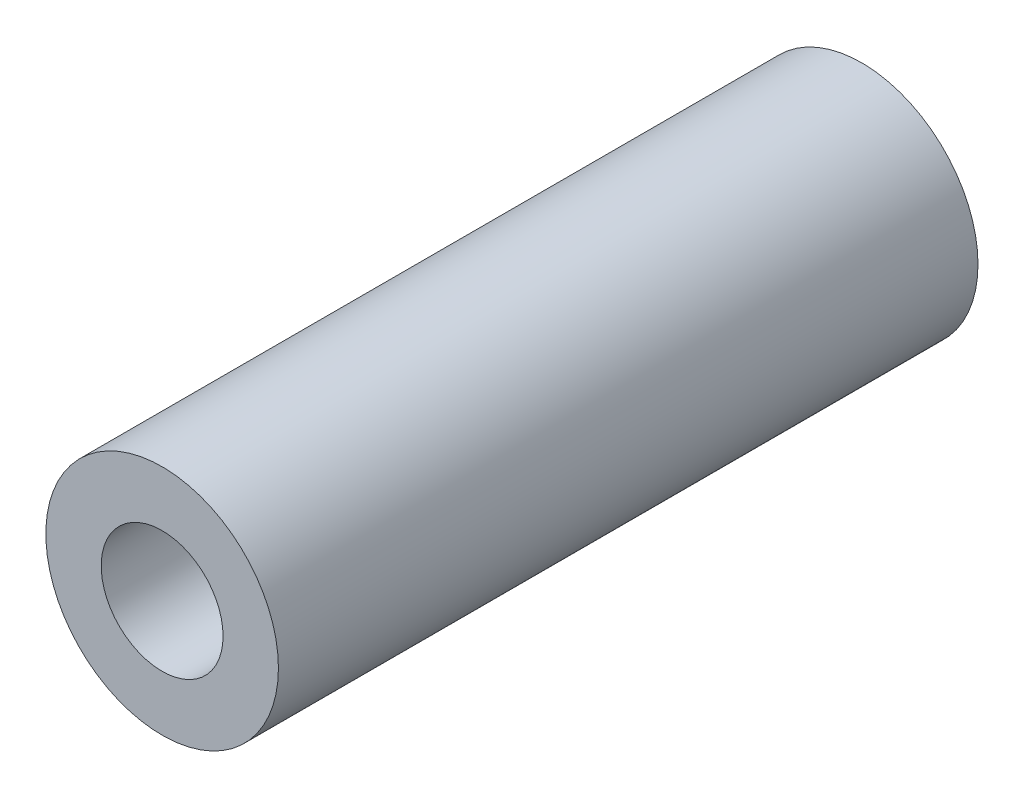
from build123d import *

# Parameters (mm, degrees)
SKETCH1_R           = 4.7498
SKETCH1_R_2         = 2.4892
BOSS_EXTRUDE1_DEPTH = 28.575


with BuildPart() as part:
    # Sketch1 → Boss-Extrude1 (new body)
    with BuildSketch(Plane.XY):
        Circle(SKETCH1_R)
        Circle(SKETCH1_R_2, mode=Mode.SUBTRACT)
    extrude(amount=BOSS_EXTRUDE1_DEPTH)


solid = part.part
